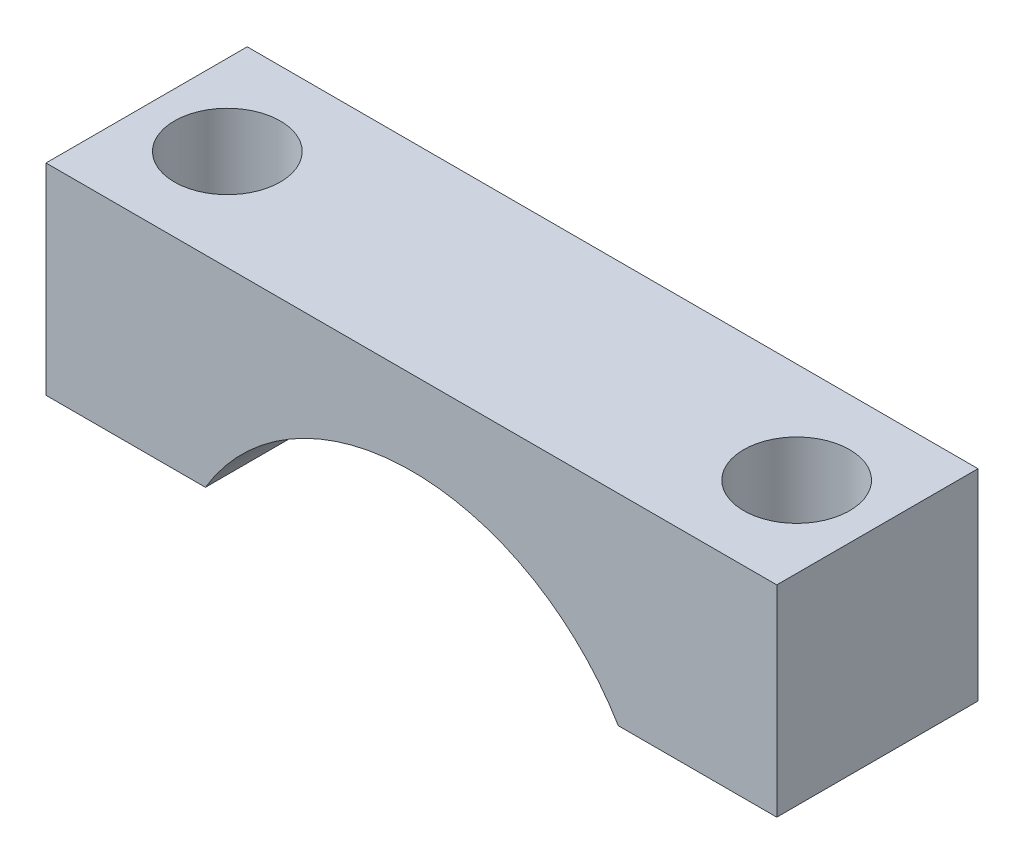
from build123d import *

# Parameters (mm, degrees)
BOSS_EXTRUDE1_DEPTH = 9.652
SKETCH2_R           = 2.54
CUT_EXTRUDE1_DEPTH  = 5.08


with BuildPart() as part:
    # Sketch1 → Boss-Extrude1 (new body)
    with BuildSketch(Plane.XY):
        with BuildLine():
            Line((2476.991807356, 1418.793197854), (2476.991807356, 1428.445197854))
            Line((2476.991807356, 1428.445197854), (2512.043807356, 1428.445197854))
            Line((2512.043807356, 1428.445197854), (2512.043807356, 1418.793197854))
            Line((2512.043807356, 1418.793197854), (2504.441139998, 1418.793197854))
            ThreePointArc((2504.441139998, 1418.793197854), (2494.539356001, 1424.421292267), (2484.637572003, 1418.793197854))
            Line((2484.637572003, 1418.793197854), (2476.991807356, 1418.793197854))
        make_face()
    extrude(amount=BOSS_EXTRUDE1_DEPTH)

    # Sketch2 → Cut-Extrude1 (cut)
    with BuildSketch(Plane(origin=(0, 1428.445197854, 0), x_dir=(1, 0, 0), z_dir=(0, 1, 0))):
        with Locations((2480.863626549, -4.826)):
            Circle(SKETCH2_R)
        with Locations((2508.171988163, -4.826)):
            Circle(SKETCH2_R)
    extrude(amount=-CUT_EXTRUDE1_DEPTH, mode=Mode.SUBTRACT)


solid = part.part
